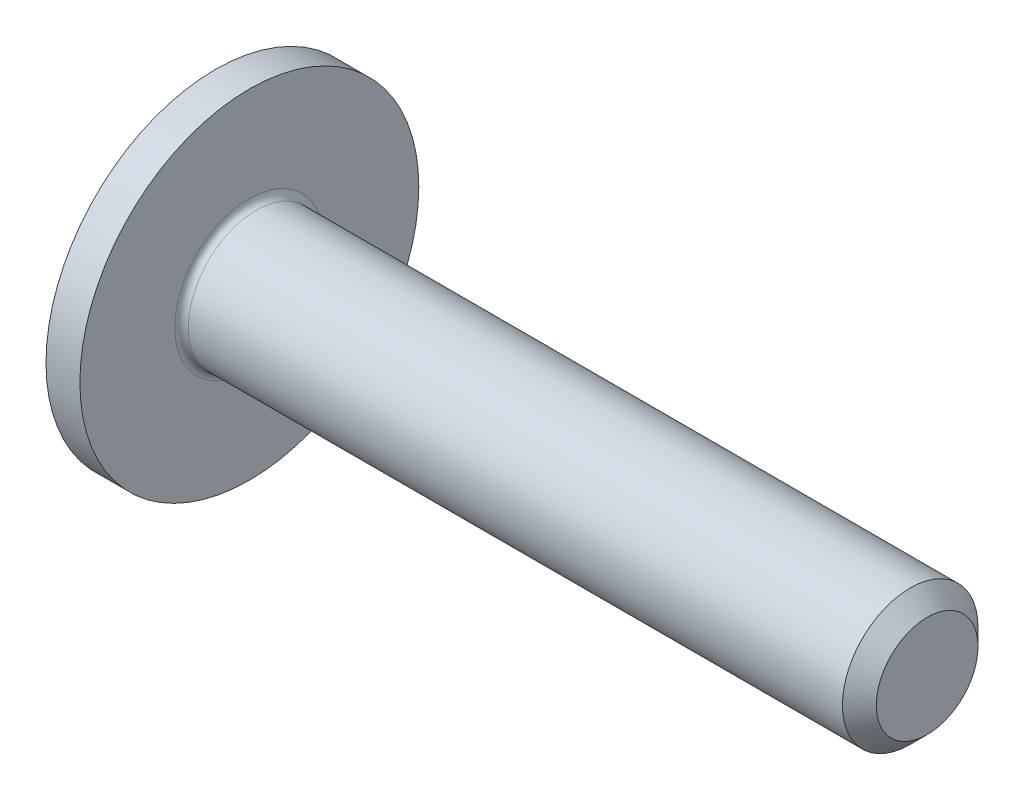
from build123d import *

# Parameters (mm, degrees)
FILLET1_R             = 0.2
RECPAT_COUNT          = 2
RECPAT_ANGLE          = 90
CHAMFER_1_SIZE        = 0.5
CUT_EXTRUDE_START     = -1.932317225
CUT_EXTRUDE_1_DEPTH   = 0.992538955
CUT_EXTRUDE_1_2_DEPTH = 0.992538955
CUT_EXTRUDE_1_3_DEPTH = 0.992538955
CUT_EXTRUDE_1_4_DEPTH = 0.992538955


# Read off the part's stored shape, not the designer's step: Вытянуть1
with BuildPart() as part:
    # BodySke → Base-Revolve (revolve)
    with BuildSketch(Plane.XY, mode=Mode.PRIVATE) as base_revolve_sk:
        Polygon((3.05, 2), (3.05, 5), (2.05, 5), (2.05, 0), (23.05, 0), (23.05, 2), align=None)
    revolve(base_revolve_sk.sketch.rotate(Axis((-6.35, 0, 0), (1, 0, 0)), 90), axis=Axis((-6.35, 0, 0), (1, 0, 0)))

    # Fillet1
    fillet1_edges = [part.edges().sort_by_distance(p)[0] for p in [
        (3.05, 0, -2),
    ]]
    fillet(fillet1_edges, radius=FILLET1_R)

    # PanSke → Pan (revolve)
    with BuildSketch(Plane.XY):
        with BuildLine():
            Line((2.05, 4.424646879), (2.05, 0))
            Line((2.05, 0), (0, 0))
            ThreePointArc((0, 0), (0.537396082, 2.438237068), (2.05, 4.424646879))
        make_face()
    revolve(axis=Axis((0, 0, 0), (1, 0, 0)))

    # Sketch3 → Recess section 0
    with BuildSketch(Plane(origin=(0, 0, 0), x_dir=(0, 0, -1), z_dir=(1, 0, 0))):
        with BuildLine():
            Line((-0.515, 2.15), (0.515, 2.15))
            Line((0.515, 2.15), (0.515, -2.15))
            Line((0.515, -2.15), (-0.515, -2.15))
            Line((-0.515, -2.15), (-0.515, 2.15))
        make_face()
    # Sketch4 → Recess section 1
    with BuildSketch(Plane(origin=(2.34, 0, 0), x_dir=(0, 0, -1), z_dir=(1, 0, 0))):
        with BuildLine():
            Line((-0.37, 1.45), (0.37, 1.45))
            Line((0.37, 1.45), (0.37, -1.45))
            Line((0.37, -1.45), (-0.37, -1.45))
            Line((-0.37, -1.45), (-0.37, 1.45))
        make_face()
    recess = loft(mode=Mode.SUBTRACT)

    # RecPat: Recess ×2 about axis
    recpat_axis = Axis((0, 0, 0), (1, 0, 0))
    for i in range(1, RECPAT_COUNT):
        add(recess.rotate(recpat_axis, i * RECPAT_ANGLE / (RECPAT_COUNT - 1)), mode=Mode.SUBTRACT)

    # RecCorSke → RecessCore (revolve, cut)
    with BuildSketch(Plane.XY, mode=Mode.PRIVATE) as recesscore_sk:
        Polygon((0, 0), (0, 1.032809711), (2.6, 0.851), (2.876506661, 0), align=None)
    revolve(recesscore_sk.sketch.rotate(Axis((-3.175, 0, 0), (1, 0, 0)), 90), axis=Axis((-3.175, 0, 0), (1, 0, 0)), mode=Mode.SUBTRACT)

    # Фаска1
    chamfer_1_edges = [part.edges().sort_by_distance(p)[0] for p in [
        (23.05, 0, -2),
    ]]
    chamfer(chamfer_1_edges, length=CHAMFER_1_SIZE)

    # Вытянуть1 outline → Вытянуть1 (cut)
    with BuildSketch(Plane(origin=(0, 0, 0), x_dir=(0.9932989193126689, -0.08172287590474257, -0.08172287590474261), z_dir=(0.1155735994606204, 0.7023684015912574, 0.7023684015912578)).offset(CUT_EXTRUDE_START)):
        Polygon((-1, -0.919204654), (0.206895578, -0.216114133), (0.577867997, 0), (0.206895578, 0.216114133), (-1, 0.919204654), align=None)
    extrude(amount=CUT_EXTRUDE_1_DEPTH, mode=Mode.SUBTRACT)

    # Cut-Extrude 1 2 outline → Cut-Extrude 1 2 (cut)
    with BuildSketch(Plane(origin=(0, 0, 0), x_dir=(0.9932989193126689, -0.08172287590474257, 0.08172287590474261), z_dir=(0.1155735994606204, 0.7023684015912574, -0.7023684015912578)).offset(CUT_EXTRUDE_START)):
        Polygon((0.206895578, -0.216114133), (0.577867997, 0), (0.206895578, 0.216114133), (-1, 0.919204654), (-1, -0.919204654), align=None)
    extrude(amount=CUT_EXTRUDE_1_2_DEPTH, mode=Mode.SUBTRACT)

    # Cut-Extrude 1 3 outline → Cut-Extrude 1 3 (cut)
    with BuildSketch(Plane(origin=(0, 0, 0), x_dir=(0.9932989193126689, 0.08172287590474257, 0.08172287590474261), z_dir=(0.1155735994606204, -0.7023684015912574, -0.7023684015912578)).offset(CUT_EXTRUDE_START)):
        Polygon((0.206895578, -0.216114133), (0.577867997, 0), (0.206895578, 0.216114133), (-1, 0.919204654), (-1, -0.919204654), align=None)
    extrude(amount=CUT_EXTRUDE_1_3_DEPTH, mode=Mode.SUBTRACT)

    # Cut-Extrude 1 4 outline → Cut-Extrude 1 4 (cut)
    with BuildSketch(Plane(origin=(0, 0, 0), x_dir=(0.9932989193126689, 0.08172287590474257, -0.08172287590474261), z_dir=(0.1155735994606204, -0.7023684015912574, 0.7023684015912578)).offset(CUT_EXTRUDE_START)):
        Polygon((-1, -0.919204654), (0.206895578, -0.216114133), (0.577867997, 0), (0.206895578, 0.216114133), (-1, 0.919204654), align=None)
    extrude(amount=CUT_EXTRUDE_1_4_DEPTH, mode=Mode.SUBTRACT)


solid = part.part
